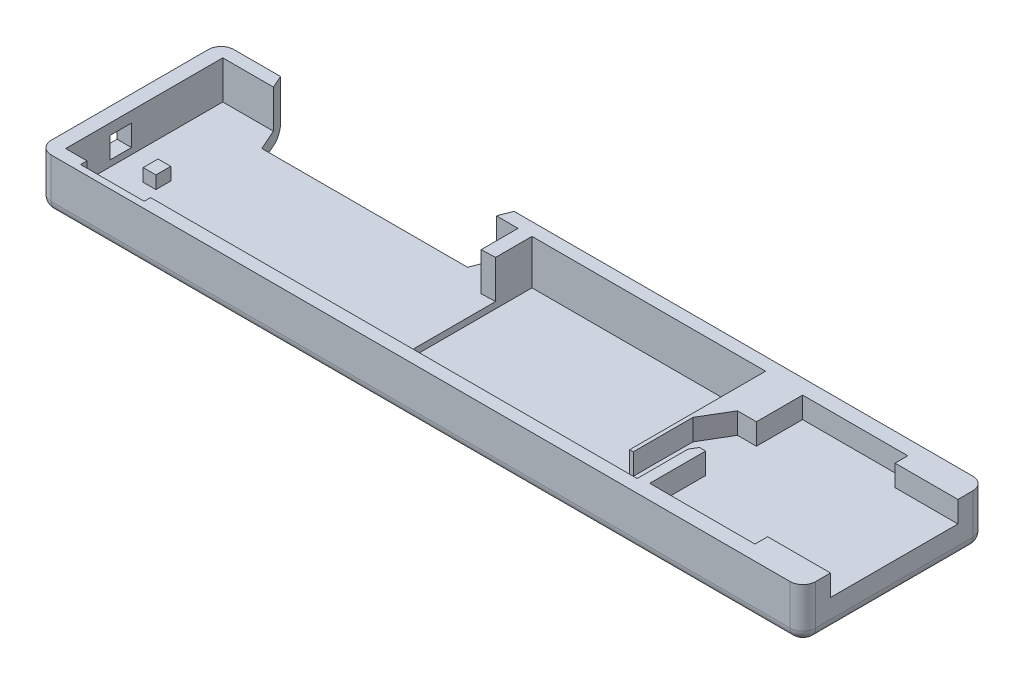
from build123d import *

# Parameters (mm, degrees)
SKETCH_3_W           = 180
SKETCH_3_H           = 43
EXTRUDE_1_DEPTH      = 12
CUT_EXTRUDE_1_DEPTH  = 52
CUT_EXTRUDE_2_DEPTH  = 5
CUT_EXTRUDE_3_DEPTH  = 5
SKETCH_8_W           = 55
SKETCH_8_H           = 37
CUT_EXTRUDE_4_DEPTH  = 10.5
CUT_EXTRUDE_5_DEPTH  = 5
SKETCH_10_W          = 62.128790526
SKETCH_10_H          = 8.683746703
CUT_EXTRUDE_6_DEPTH  = 8
CUT_EXTRUDE_8_DEPTH  = 9
FILLET_3_R           = 3
FILLET_4_R           = 2.5
SKETCH_12_W          = 15
SKETCH_12_H          = 1.5
CUT_EXTRUDE_9_DEPTH  = 5.5
CUT_EXTRUDE_10_DEPTH = 5.5
SKETCH_15_W          = 3
SKETCH_15_H          = 3.5
EXTRUDE_2_DEPTH      = 3


with BuildPart() as part:
    # 草图3 → 凸台-拉伸1 (new body)
    with BuildSketch(Plane(origin=(0, 0, 0), x_dir=(1, 0, 0), z_dir=(0, 1, 0))):
        with Locations((50.068597249, 7.753123643)):
            Rectangle(SKETCH_3_W, SKETCH_3_H)
    extrude(amount=EXTRUDE_1_DEPTH)

    # 草图4 → 切除-拉伸1 (cut)
    with BuildSketch(Plane(origin=(0, 0, 0), x_dir=(1, 0, 0), z_dir=(0, 1, 0))):
        Polygon((-22.469613434, -5.858946979), (26.002261286, -5.858946979), (29.068597249, -13.746876357), (-25.931402751, -13.746876357), align=None)
    extrude(amount=CUT_EXTRUDE_1_DEPTH, mode=Mode.SUBTRACT)

    # 草图5 → 切除-拉伸2 (cut)
    with BuildSketch(Plane(origin=(0, 12, 0), x_dir=(1, 0, 0), z_dir=(0, 1, 0))):
        Polygon((140.068597249, 7.753123643), (140.068597249, 22.753123643), (125.276479966, 22.753123643), (125.276479966, -7.246876357), (140.068597249, -7.246876357), align=None)
    extrude(amount=-CUT_EXTRUDE_2_DEPTH, mode=Mode.SUBTRACT)

    # 草图7 → 切除-拉伸3 (cut)
    with BuildSketch(Plane(origin=(0, 12, 0), x_dir=(1, 0, 0), z_dir=(0, 1, 0))):
        Polygon((125.276479966, 7.753123643), (125.276479966, 25.753123643), (100.500825538, 25.753123643), (100.500825538, -10.246876357), (125.276479966, -10.246876357), align=None)
    extrude(amount=-CUT_EXTRUDE_3_DEPTH, mode=Mode.SUBTRACT)

    # 草图8 → 切除-拉伸4 (cut)
    with BuildSketch(Plane(origin=(0, 12, 0), x_dir=(1, 0, 0), z_dir=(0, 1, 0))):
        with Locations((63.776287419, 7.753123643)):
            Rectangle(SKETCH_8_W, SKETCH_8_H)
    extrude(amount=-CUT_EXTRUDE_4_DEPTH, mode=Mode.SUBTRACT)

    # 草图9 → 切除-拉伸5 (cut)
    with BuildSketch(Plane(origin=(0, 12, 0), x_dir=(1, 0, 0), z_dir=(0, 1, 0))):
        Polygon((91.276287419, 26.253123643), (98.039619719, 26.253123643), (98.039619719, 22.130591531), (98.039619719, 14.279735666), (99.048577369, 12.579380219), (100.500825538, 12.579380219), (100.500825538, 0.629591822), (96.047349228, 0.629591822), (92.132656028, 7.226865659), (92.132656028, 21.255120764), (91.276287419, 21.255120764), align=None)
    extrude(amount=-CUT_EXTRUDE_5_DEPTH, mode=Mode.SUBTRACT)

    # 草图10 → 切除-拉伸6 (cut)
    with BuildSketch(Plane(origin=(0, 12, 0), x_dir=(1, 0, 0), z_dir=(0, 1, 0))):
        with Locations((1.934159822, -6.405003006)):
            Rectangle(SKETCH_10_W, SKETCH_10_H)
    extrude(amount=-CUT_EXTRUDE_6_DEPTH, mode=Mode.SUBTRACT)

    # 草图11 → 切除-拉伸8 (cut)
    with BuildSketch(Plane(origin=(0, 12, 0), x_dir=(1, 0, 0), z_dir=(0, 1, 0))):
        Polygon((32.998555085, -10.746876357), (-36.5396752, -10.746876357), (-36.5396752, 26.253123643), (36.276287419, 26.253123643), (36.276287419, -2.167243749), (32.998555085, -2.063129654), align=None)
    extrude(amount=-CUT_EXTRUDE_8_DEPTH, mode=Mode.SUBTRACT)

    # 圆角3
    fillet_3_edges = [part.edges().sort_by_distance(p)[0] for p in [
        (140.068597249, 6, -29.253123643),
        (140.068597249, 6, 13.746876357),
        (-39.931402751, 6, 13.746876357),
        (-39.931402751, 6, -29.253123643),
    ]]
    fillet(fillet_3_edges, radius=FILLET_3_R)

    # 圆角4
    fillet_4_edges = [part.edges().sort_by_distance(p)[0] for p in [
        (50.068597249, 0, -29.253123643),
        (-39.052723094, 0, 12.8681967),
        (-31.431402751, 0, 13.746876357),
        (83.068597249, 0, 13.746876357),
        (139.189917593, 0, 12.8681967),
        (140.068597249, 0, -7.753123643),
        (139.189917593, 0, -28.374443987),
        (-39.052723094, 0, -28.374443987),
        (-39.931402751, 0, -7.753123643),
    ]]
    fillet(fillet_4_edges, radius=FILLET_4_R)

    # 草图12 → 切除-拉伸9 (cut)
    with BuildSketch(Plane(origin=(0, 12, 0), x_dir=(1, 0, 0), z_dir=(0, 1, 0))):
        with Locations((-24.0396752, 27.003123643)):
            Rectangle(SKETCH_12_W, SKETCH_12_H)
    extrude(amount=-CUT_EXTRUDE_9_DEPTH, mode=Mode.SUBTRACT)

    # 草图14 → 切除-拉伸10 (cut)
    with BuildSketch(Plane(origin=(-36.5396752, 0, 0), x_dir=(0, 0, -1), z_dir=(1, 0, 0))):
        Polygon((13.253123643, 9.45), (10.753123643, 9.45), (10.753123643, 4.45), (15.753123643, 4.45), (15.753123643, 9.45), align=None)
    extrude(amount=-CUT_EXTRUDE_10_DEPTH, mode=Mode.SUBTRACT)

    # 草图15 → 凸台-拉伸2 (add)
    with BuildSketch(Plane(origin=(0, 3, 0), x_dir=(1, 0, 0), z_dir=(0, 1, 0))):
        with Locations((-28.0396752, 13.253123643)):
            Rectangle(SKETCH_15_W, SKETCH_15_H)
    extrude(amount=EXTRUDE_2_DEPTH)


with BuildPart() as body_2:
    # 镜向3: mirrored copy
    add(part.part.mirror(Plane(origin=(0, 0, -39.253123643), x_dir=(1, 0, 0), z_dir=(0, 0, -1))))


solid = body_2.part
